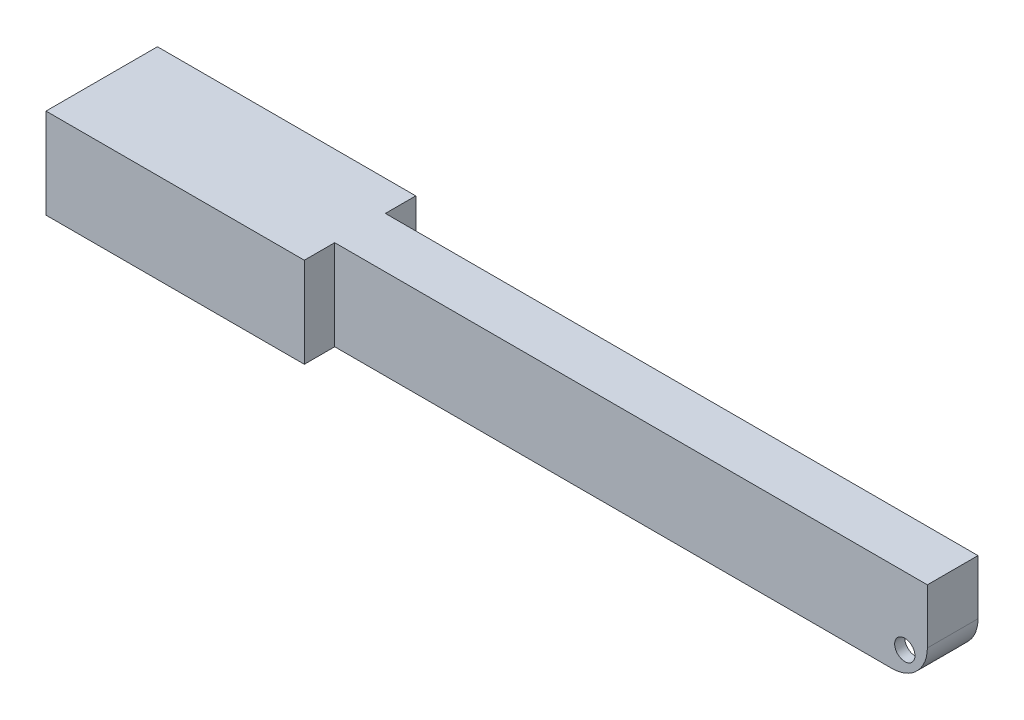
from build123d import *

# Parameters (mm, degrees)
SKETCH1_W           = 168
SKETCH1_H           = 22
BOSS_EXTRUDE1_DEPTH = 17.8
SKETCH8_R           = 2
CUT_EXTRUDE4_DEPTH  = 22
CUT_EXTRUDE2_REACH  = 88.567
SKETCH5_W           = 117
SKETCH5_H           = 6
CUT_EXTRUDE3_DEPTH  = 15.8
BOSS_EXTRUDE3_REACH = 90.164
SKETCH7_W           = 47
SKETCH7_H           = 2
FILLET1_R           = 7


with BuildPart() as part:
    # Sketch1 → Boss-Extrude1 (new body)
    with BuildSketch(Plane(origin=(0, 0, 0), x_dir=(1, 0, 0), z_dir=(0, 1, 0))):
        Rectangle(SKETCH1_W, SKETCH1_H)
    extrude(amount=-BOSS_EXTRUDE1_DEPTH)

    # Sketch8 → Cut-Extrude4 (cut)
    with BuildSketch(Plane.XY.offset(11)):
        with Locations((79.55, -13.35)):
            Circle(SKETCH8_R)
    extrude(amount=-CUT_EXTRUDE4_DEPTH, mode=Mode.SUBTRACT)

    # Cut-Extrude2: up to this face of the body (flat: up to its plane)
    cut_extrude2_end = Plane(part.part.faces().sort_by_distance((0, -17.8, 0))[0])
    # Sketch5 → Cut-Extrude2 (cut, up to the picked face)
    with BuildSketch(Plane(origin=(0, 0, 0), x_dir=(1, 0, 0), z_dir=(0, 1, 0)), mode=Mode.PRIVATE) as cut_extrude2_sk1:
        with Locations((25.5, 8)):
            Rectangle(SKETCH5_W, SKETCH5_H)
    cut_extrude2_tool1 = split(extrude(cut_extrude2_sk1.sketch, amount=-CUT_EXTRUDE2_REACH, mode=Mode.PRIVATE), bisect_by=cut_extrude2_end, keep=Keep.BOTH, mode=Mode.PRIVATE)
    # Sketch5 → Cut-Extrude2 (cut, up to the picked face)
    with BuildSketch(Plane(origin=(0, 0, 0), x_dir=(1, 0, 0), z_dir=(0, 1, 0)), mode=Mode.PRIVATE) as cut_extrude2_sk2:
        with Locations((25.5, -8)):
            Rectangle(SKETCH5_W, SKETCH5_H)
    cut_extrude2_tool2 = split(extrude(cut_extrude2_sk2.sketch, amount=-CUT_EXTRUDE2_REACH, mode=Mode.PRIVATE), bisect_by=cut_extrude2_end, keep=Keep.BOTH, mode=Mode.PRIVATE)
    add(cut_extrude2_tool1.solids().sort_by(Axis((25.5, 0, -8), (0, -1, 0)))[0], mode=Mode.SUBTRACT)
    add(cut_extrude2_tool2.solids().sort_by(Axis((25.5, 0, 8), (0, -1, 0)))[0], mode=Mode.SUBTRACT)

    # Sketch6 → Cut-Extrude3 (cut)
    with BuildSketch(Plane.XZ.offset(17.8)):
        Polygon((-82, 9), (-82, -9), (-35, -9), (-35, -3), (82, -3), (82, 3), (-35, 3), (-35, 9), align=None)
    extrude(amount=-CUT_EXTRUDE3_DEPTH, mode=Mode.SUBTRACT)

    # Boss-Extrude3: up to this face of the body (flat: up to its plane)
    boss_extrude3_end = Plane(part.part.faces().sort_by_distance((-58.5, -9.9, 9))[0])
    # Sketch7 → Boss-Extrude3 (add, up to the picked face)
    with BuildSketch(Plane.XY.offset(-9), mode=Mode.PRIVATE) as boss_extrude3_sk1:
        with Locations((-58.5, -13.3)):
            Rectangle(SKETCH7_W, SKETCH7_H)
    boss_extrude3_tool1 = split(extrude(boss_extrude3_sk1.sketch, amount=BOSS_EXTRUDE3_REACH, mode=Mode.PRIVATE), bisect_by=boss_extrude3_end, keep=Keep.BOTH, mode=Mode.PRIVATE)
    add(boss_extrude3_tool1.solids().sort_by(Axis((-58.5, -13.3, -9), (0, 0, 1)))[0])

    # Fillet1
    # the kernel refuses this fillet: 7 mm, written as the material it takes off along each edge
    with BuildSketch(Plane(origin=(84, -17.8, 22.5), x_dir=(-1, 0, 0), z_dir=(0, 0, -1))) as fillet1_piece_1:
        with BuildLine():
            CenterArc((FILLET1_R, FILLET1_R), FILLET1_R, 180, 90)
            Line((0, FILLET1_R), (0, 0))
            Line((0, 0), (FILLET1_R, 0))
        make_face()
    extrude(amount=45, mode=Mode.SUBTRACT)


solid = part.part
